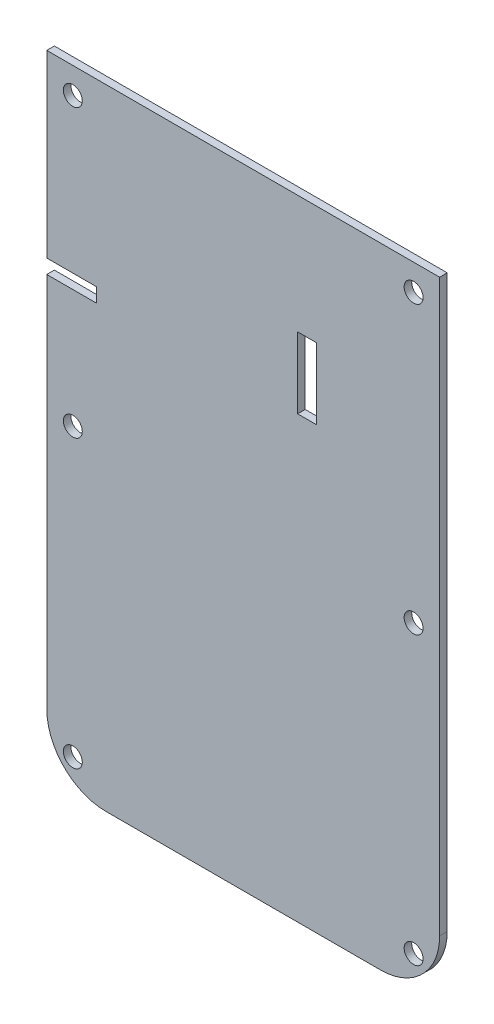
from build123d import *

# Parameters (mm, degrees)
EXTRUDE_1_DEPTH     = 0.8
SKETCH_2_R          = 1
SKETCH_2_W          = 5.25
SKETCH_2_H          = 1.5
SKETCH_2_W_2        = 2
SKETCH_2_H_2        = 7.5
CUT_EXTRUDE_1_DEPTH = 79.390943354


with BuildPart() as part:
    # 草图1 → 凸台-拉伸1 (new body)
    with BuildSketch(Plane.XY):
        with BuildLine():
            Line((-41.5, 66.5), (0, 66.5))
            Line((0, 66.5), (0, 6.25))
            ThreePointArc((0, 6.25), (-1.830582618, 1.830582618), (-6.25, 0))
            Line((-6.25, 0), (-35.25, 0))
            ThreePointArc((-35.25, 0), (-39.669417382, 1.830582618), (-41.5, 6.25))
            Line((-41.5, 6.25), (-41.5, 66.5))
        make_face()
    extrude(amount=EXTRUDE_1_DEPTH)

    # 草图2 → 切除-拉伸1 (cut, through all)
    with BuildSketch(Plane.XY.offset(0.8)):
        with Locations((-38.75, 63.75)):
            Circle(SKETCH_2_R)
        with Locations((-38.75, 33.5)):
            Circle(SKETCH_2_R)
        with Locations((-38.75, 3.25)):
            Circle(SKETCH_2_R)
        with Locations((-2.75, 3.25)):
            Circle(SKETCH_2_R)
        with Locations((-2.75, 33.5)):
            Circle(SKETCH_2_R)
        with Locations((-2.75, 63.75)):
            Circle(SKETCH_2_R)
        with Locations((-38.875, 46.75)):
            Rectangle(SKETCH_2_W, SKETCH_2_H)
        with Locations((-14, 50.25)):
            Rectangle(SKETCH_2_W_2, SKETCH_2_H_2)
    extrude(amount=-CUT_EXTRUDE_1_DEPTH, mode=Mode.SUBTRACT)


solid = part.part
